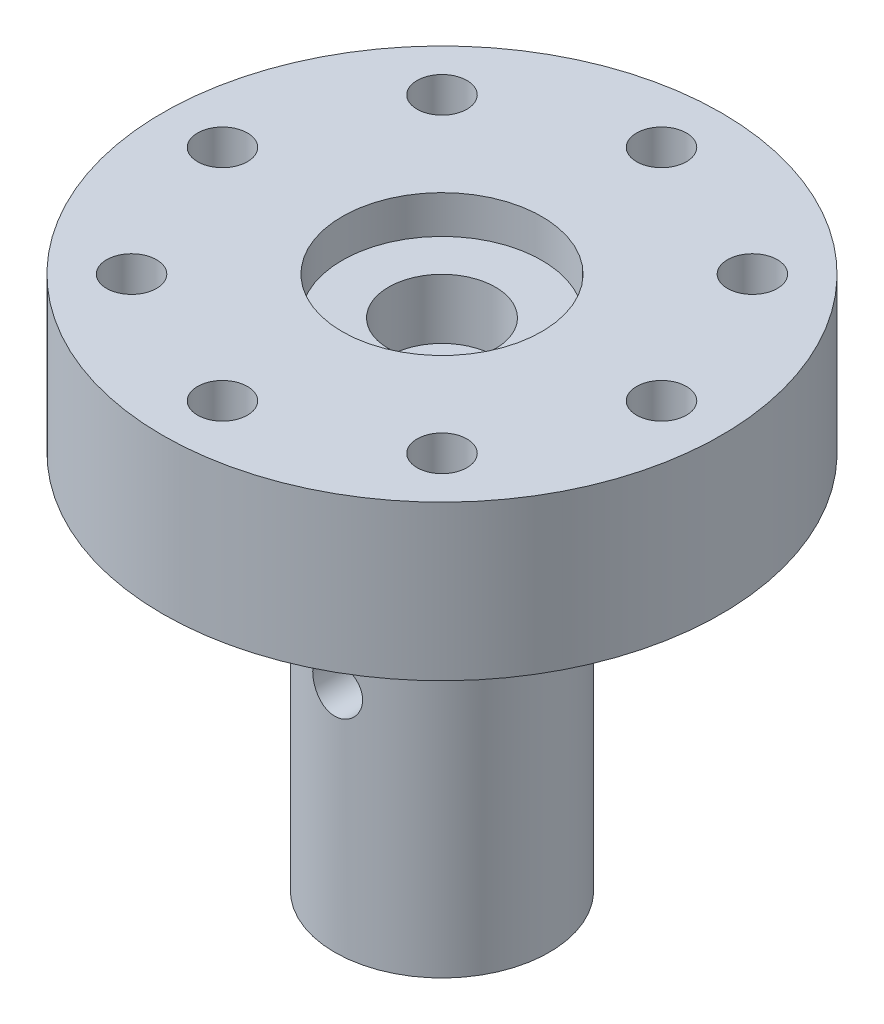
from build123d import *

# Parameters (mm, degrees)
SKETCH1_R               = 14
SKETCH1_R_2             = 1.25
BOSS_EXTRUDE1_DEPTH     = 7.75
SKETCH2_R               = 5
CUT_EXTRUDE1_DEPTH      = 1.9
SKETCH5_R               = 2.675
CUT_EXTRUDE3_DEPTH      = 3
SKETCH3_R               = 5.375
BOSS_EXTRUDE2_DEPTH     = 19
CUT_EXTRUDE4_DEPTH      = 28.440845468
CUT_EXTRUDE4_DEPTH_BACK = 28.440845468
SKETCH4_R               = 1.25


with BuildPart() as part:
    # Sketch1 → Boss-Extrude1 (new body)
    with BuildSketch(Plane(origin=(0, 0, 0), x_dir=(1, 0, 0), z_dir=(0, 1, 0))):
        Circle(SKETCH1_R)
        with Locations((-7.778174593, 7.778174593)):
            Circle(SKETCH1_R_2, mode=Mode.SUBTRACT)
        with Locations((0, 11)):
            Circle(SKETCH1_R_2, mode=Mode.SUBTRACT)
        with Locations((7.778174593, 7.778174593)):
            Circle(SKETCH1_R_2, mode=Mode.SUBTRACT)
        with Locations((11, 0)):
            Circle(SKETCH1_R_2, mode=Mode.SUBTRACT)
        with Locations((7.778174593, -7.778174593)):
            Circle(SKETCH1_R_2, mode=Mode.SUBTRACT)
        with Locations((0, -11)):
            Circle(SKETCH1_R_2, mode=Mode.SUBTRACT)
        with Locations((-11, 0)):
            Circle(SKETCH1_R_2, mode=Mode.SUBTRACT)
        with Locations((-7.778174593, -7.778174593)):
            Circle(SKETCH1_R_2, mode=Mode.SUBTRACT)
    extrude(amount=BOSS_EXTRUDE1_DEPTH)

    # Sketch2 → Cut-Extrude1 (cut)
    with BuildSketch(Plane(origin=(0, 7.75, 0), x_dir=(1, 0, 0), z_dir=(0, 1, 0))):
        Circle(SKETCH2_R)
    extrude(amount=-CUT_EXTRUDE1_DEPTH, mode=Mode.SUBTRACT)

    # Sketch5 → Cut-Extrude3 (cut)
    with BuildSketch(Plane(origin=(0, 5.85, 0), x_dir=(1, 0, 0), z_dir=(0, 1, 0))):
        Circle(SKETCH5_R)
    extrude(amount=-CUT_EXTRUDE3_DEPTH, mode=Mode.SUBTRACT)

    # Sketch3 → Boss-Extrude2 (add)
    with BuildSketch(Plane.XZ):
        Circle(SKETCH3_R)
    extrude(amount=BOSS_EXTRUDE2_DEPTH)

    # Sketch4 → Cut-Extrude4 (cut, two sides: drawn at the far end of the back side and taken through both)
    with BuildSketch(Plane.XY.offset(-CUT_EXTRUDE4_DEPTH_BACK)):
        with Locations((0, -7.5)):
            Circle(SKETCH4_R)
    extrude(amount=CUT_EXTRUDE4_DEPTH + CUT_EXTRUDE4_DEPTH_BACK, mode=Mode.SUBTRACT)


solid = part.part
